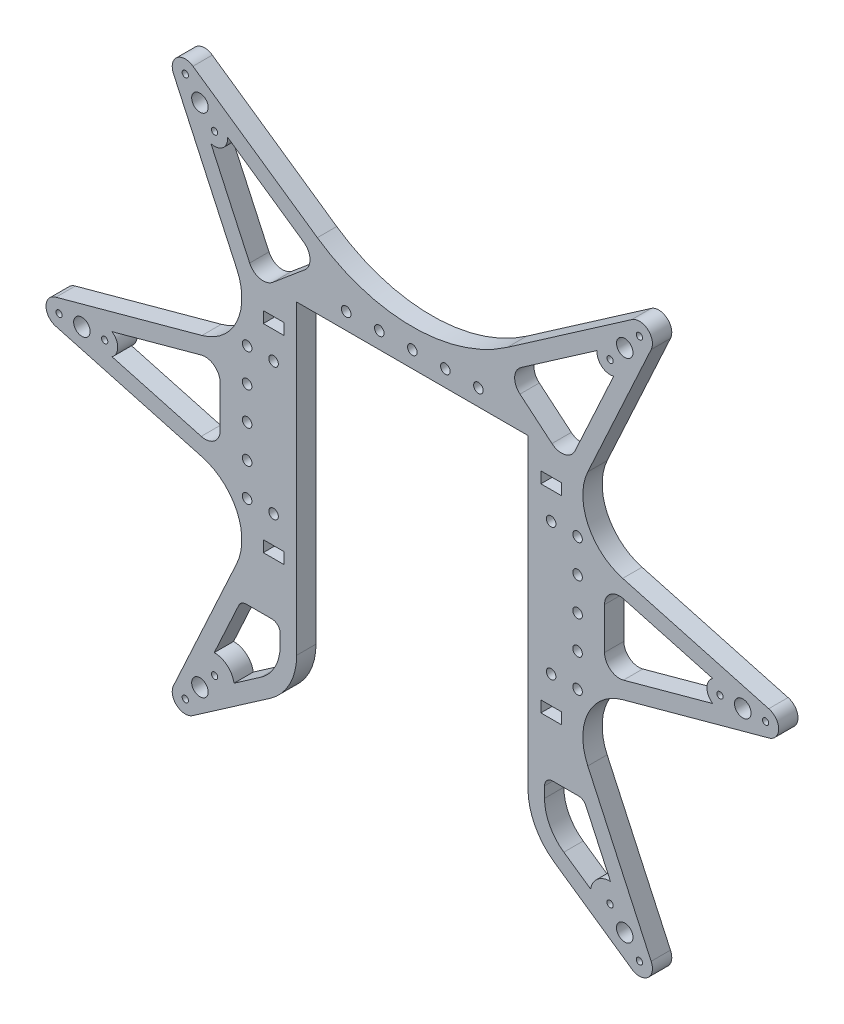
from build123d import *

# Parameters (mm, degrees)
SKETCH1_R           = 0.95
SKETCH1_R_2         = 2.5
SKETCH1_R_3         = 1.449999999
SKETCH1_R_4         = 1.45
SKETCH1_W           = 6.2
SKETCH1_H           = 3.4
BOSS_EXTRUDE1_DEPTH = 5.85


with BuildPart() as part:
    # Sketch1 → Boss-Extrude1 (new body)
    with BuildSketch(Plane.XY):
        with BuildLine():
            Line((576.616706289, 434.650231372), (532.426650002, 446.716128422))
            ThreePointArc((532.426650002, 446.716128422), (529.426650002, 450.550186325), (532.426650002, 454.384244227))
            Line((532.426650002, 454.384244227), (576.616706289, 466.450141278))
            ThreePointArc((576.616706289, 466.450141278), (587.144059076, 475.326320371), (587.176754813, 489.096238418))
            Line((587.176754813, 489.096238418), (568.014947547, 530.703594601))
            ThreePointArc((568.014947547, 530.703594601), (569.023643468, 535.466212845), (573.889065048, 535.63256443))
            Line((573.889065048, 535.63256443), (611.536899087, 509.536826494))
            ThreePointArc((611.536899087, 509.536826494), (640.276650002, 500.550186325), (669.016400917, 509.536826494))
            Line((669.016400917, 509.536826494), (706.664234956, 535.63256443))
            ThreePointArc((706.664234956, 535.63256443), (711.529656536, 535.466212845), (712.538352458, 530.703594601))
            Line((712.538352458, 530.703594601), (693.376545192, 489.096238418))
            ThreePointArc((693.376545192, 489.096238418), (693.409240928, 475.326320371), (703.936593716, 466.450141278))
            Line((703.936593716, 466.450141278), (748.126650002, 454.384244227))
            ThreePointArc((748.126650002, 454.384244227), (751.126650002, 450.550186325), (748.126650002, 446.716128422))
            Line((748.126650002, 446.716128422), (703.936593716, 434.650231372))
            ThreePointArc((703.936593716, 434.650231372), (693.409240928, 425.774052279), (693.376545192, 412.004134232))
            Line((693.376545192, 412.004134232), (712.538352458, 370.396778049))
            ThreePointArc((712.538352458, 370.396778049), (711.529656536, 365.634159805), (706.664234956, 365.46780822))
            Line((706.664234956, 365.46780822), (683.276650002, 381.679000803))
            ThreePointArc((683.276650002, 381.679000803), (677.397639803, 388.334757147), (675.276650002, 396.958170375))
            Line((675.276650002, 396.958170375), (675.276650002, 489.550186325))
            Line((675.276650002, 489.550186325), (605.276650002, 489.550186325))
            Line((605.276650002, 489.550186325), (605.276650002, 396.958170375))
            ThreePointArc((605.276650002, 396.958170375), (603.155660202, 388.334757147), (597.276650002, 381.679000803))
            Line((597.276650002, 381.679000803), (573.889065048, 365.46780822))
            ThreePointArc((573.889065048, 365.46780822), (569.023643468, 365.634159805), (568.014947547, 370.396778049))
            Line((568.014947547, 370.396778049), (587.176754813, 412.004134232))
            ThreePointArc((587.176754813, 412.004134232), (587.144059076, 425.774052279), (576.616706289, 434.650231372))
        make_face()
        with Locations((533.376650002, 450.550186325)):
            Circle(SKETCH1_R, mode=Mode.SUBTRACT)
        with Locations((575.997889034, 527.154630637)):
            Circle(SKETCH1_R_2, mode=Mode.SUBTRACT)
        with Locations((547.176650002, 450.550186325)):
            Circle(SKETCH1_R, mode=Mode.SUBTRACT)
        with Locations((540.276650002, 450.550186325)):
            Circle(SKETCH1_R_2, mode=Mode.SUBTRACT)
        with Locations((590.276650002, 460.550186325)):
            Circle(SKETCH1_R_3, mode=Mode.SUBTRACT)
        with Locations((571.562654527, 532.440337294)):
            Circle(SKETCH1_R, mode=Mode.SUBTRACT)
        with Locations((580.43312354, 521.868923979)):
            Circle(SKETCH1_R, mode=Mode.SUBTRACT)
        with Locations((682.276650002, 470.550186325)):
            Circle(SKETCH1_R_4, mode=Mode.SUBTRACT)
        with Locations((630.276650002, 494.550186325)):
            Circle(SKETCH1_R_4, mode=Mode.SUBTRACT)
        with Locations((620.276650002, 494.550186325)):
            Circle(SKETCH1_R_4, mode=Mode.SUBTRACT)
        with Locations((580.43312354, 379.231448671)):
            Circle(SKETCH1_R, mode=Mode.SUBTRACT)
        with Locations((575.997889034, 373.945742013)):
            Circle(SKETCH1_R_2, mode=Mode.SUBTRACT)
        with Locations((571.562654527, 368.660035356)):
            Circle(SKETCH1_R, mode=Mode.SUBTRACT)
        with Locations((590.276650002, 430.550186325)):
            Circle(SKETCH1_R_3, mode=Mode.SUBTRACT)
        with Locations((590.276650002, 440.550186325)):
            Circle(SKETCH1_R_3, mode=Mode.SUBTRACT)
        with Locations((590.276650002, 470.550186325)):
            Circle(SKETCH1_R_3, mode=Mode.SUBTRACT)
        with Locations((682.276650002, 430.550186325)):
            Circle(SKETCH1_R_4, mode=Mode.SUBTRACT)
        with Locations((708.990645478, 368.660035356)):
            Circle(SKETCH1_R, mode=Mode.SUBTRACT)
        with Locations((704.555410971, 373.945742013)):
            Circle(SKETCH1_R_2, mode=Mode.SUBTRACT)
        with Locations((700.120176464, 379.231448671)):
            Circle(SKETCH1_R, mode=Mode.SUBTRACT)
        with Locations((660.276650002, 494.550186325)):
            Circle(SKETCH1_R_4, mode=Mode.SUBTRACT)
        with Locations((650.276650002, 494.550186325)):
            Circle(SKETCH1_R_4, mode=Mode.SUBTRACT)
        with Locations((700.120176464, 521.868923979)):
            Circle(SKETCH1_R, mode=Mode.SUBTRACT)
        with Locations((708.990645478, 532.440337294)):
            Circle(SKETCH1_R, mode=Mode.SUBTRACT)
        with Locations((690.276650002, 450.550186325)):
            Circle(SKETCH1_R_3, mode=Mode.SUBTRACT)
        with Locations((740.276650002, 450.550186325)):
            Circle(SKETCH1_R_2, mode=Mode.SUBTRACT)
        with Locations((733.376650002, 450.550186325)):
            Circle(SKETCH1_R, mode=Mode.SUBTRACT)
        with Locations((704.555410971, 527.154630637)):
            Circle(SKETCH1_R_2, mode=Mode.SUBTRACT)
        with Locations((747.176650002, 450.550186325)):
            Circle(SKETCH1_R, mode=Mode.SUBTRACT)
        with Locations((690.276650002, 470.550186325)):
            Circle(SKETCH1_R_3, mode=Mode.SUBTRACT)
        with Locations((640.276650002, 494.550186325)):
            Circle(SKETCH1_R_4, mode=Mode.SUBTRACT)
        with Locations((690.276650002, 440.550186325)):
            Circle(SKETCH1_R_3, mode=Mode.SUBTRACT)
        with Locations((690.276650002, 430.550186325)):
            Circle(SKETCH1_R_3, mode=Mode.SUBTRACT)
        with Locations((690.276650002, 460.550186325)):
            Circle(SKETCH1_R_3, mode=Mode.SUBTRACT)
        with Locations((590.276650002, 450.550186325)):
            Circle(SKETCH1_R_3, mode=Mode.SUBTRACT)
        with Locations((598.276650002, 430.550186325)):
            Circle(SKETCH1_R_4, mode=Mode.SUBTRACT)
        with Locations((598.276650002, 470.550186325)):
            Circle(SKETCH1_R_4, mode=Mode.SUBTRACT)
        with BuildLine():
            Line((549.378217697, 453.82975942), (576.389421361, 461.205047663))
            ThreePointArc((576.389421361, 461.205047663), (580.337323048, 460.434368256), (582.12067631, 456.828882764))
            Line((582.12067631, 456.828882764), (582.12067631, 444.271489885))
            ThreePointArc((582.12067631, 444.271489885), (580.337323048, 440.666004394), (576.389421361, 439.895324987))
            Line((576.389421361, 439.895324987), (549.378217697, 447.27061323))
            ThreePointArc((549.378217697, 447.27061323), (551.126650002, 450.550186325), (549.378217697, 453.82975942))
        make_face(mode=Mode.SUBTRACT)
        with BuildLine():
            Line((590.015887334, 402.739634304), (597.776650002, 402.739634304))
            ThreePointArc((597.776650002, 402.739634304), (599.544416955, 402.007401257), (600.276650002, 400.239634304))
            Line((600.276650002, 400.239634304), (600.276650002, 396.958170375))
            ThreePointArc((600.276650002, 396.958170375), (598.726100476, 390.65402441), (594.428250258, 385.788333948))
            Line((594.428250258, 385.788333948), (586.310038369, 380.161164806))
            ThreePointArc((586.310038369, 380.161164806), (584.257709818, 383.789413107), (580.328199648, 385.180523471))
            Line((580.328199648, 385.180523471), (587.745126051, 401.285408274))
            ThreePointArc((587.745126051, 401.285408274), (588.667635675, 402.34491753), (590.015887334, 402.739634304))
        make_face(mode=Mode.SUBTRACT)
        with Locations((598.276650002, 420.515790438)):
            Rectangle(SKETCH1_W, SKETCH1_H, mode=Mode.SUBTRACT)
        with BuildLine():
            Line((694.243261635, 380.161164806), (686.125049746, 385.788333948))
            ThreePointArc((686.125049746, 385.788333948), (681.827199528, 390.65402441), (680.276650002, 396.958170375))
            Line((680.276650002, 396.958170375), (680.276650002, 400.239634304))
            ThreePointArc((680.276650002, 400.239634304), (681.008883049, 402.007401257), (682.776650002, 402.739634304))
            Line((682.776650002, 402.739634304), (690.53741267, 402.739634304))
            ThreePointArc((690.53741267, 402.739634304), (691.88566433, 402.34491753), (692.808173953, 401.285408274))
            Line((692.808173953, 401.285408274), (700.225100356, 385.180523471))
            ThreePointArc((700.225100356, 385.180523471), (696.295590186, 383.789413107), (694.243261635, 380.161164806))
        make_face(mode=Mode.SUBTRACT)
        with BuildLine():
            Line((579.335965232, 518.07435633), (591.048633694, 492.641829961))
            ThreePointArc((591.048633694, 492.641829961), (594.150648115, 490.133983107), (598.026414137, 491.077501553))
            Line((598.026414137, 491.077501553), (607.701712221, 499.196040607))
            ThreePointArc((607.701712221, 499.196040607), (609.303916208, 502.849084775), (607.372828334, 506.339455663))
            Line((607.372828334, 506.339455663), (584.360562722, 522.29049423))
            ThreePointArc((584.360562722, 522.29049423), (582.972134599, 518.843048429), (579.335965232, 518.07435633))
        make_face(mode=Mode.SUBTRACT)
        with Locations((682.276650002, 480.550186325)):
            Rectangle(SKETCH1_W, SKETCH1_H, mode=Mode.SUBTRACT)
        with BuildLine():
            Line((672.851587783, 499.196040607), (682.526885868, 491.077501553))
            ThreePointArc((682.526885868, 491.077501553), (686.402651889, 490.133983107), (689.50466631, 492.641829961))
            Line((689.50466631, 492.641829961), (701.217334773, 518.07435633))
            ThreePointArc((701.217334773, 518.07435633), (697.581165406, 518.843048429), (696.192737283, 522.29049423))
            Line((696.192737283, 522.29049423), (673.18047167, 506.339455663))
            ThreePointArc((673.18047167, 506.339455663), (671.249383797, 502.849084775), (672.851587783, 499.196040607))
        make_face(mode=Mode.SUBTRACT)
        with BuildLine():
            Line((698.432623695, 456.828882764), (698.432623695, 444.271489885))
            ThreePointArc((698.432623695, 444.271489885), (700.215976956, 440.666004394), (704.163878644, 439.895324987))
            Line((704.163878644, 439.895324987), (731.175082307, 447.27061323))
            ThreePointArc((731.175082307, 447.27061323), (729.426650002, 450.550186325), (731.175082307, 453.82975942))
            Line((731.175082307, 453.82975942), (704.163878644, 461.205047663))
            ThreePointArc((704.163878644, 461.205047663), (700.215976956, 460.434368256), (698.432623695, 456.828882764))
        make_face(mode=Mode.SUBTRACT)
        with Locations((682.276650002, 420.515790438)):
            Rectangle(SKETCH1_W, SKETCH1_H, mode=Mode.SUBTRACT)
        with Locations((598.276650002, 480.550186325)):
            Rectangle(SKETCH1_W, SKETCH1_H, mode=Mode.SUBTRACT)
    extrude(amount=BOSS_EXTRUDE1_DEPTH)


solid = part.part
